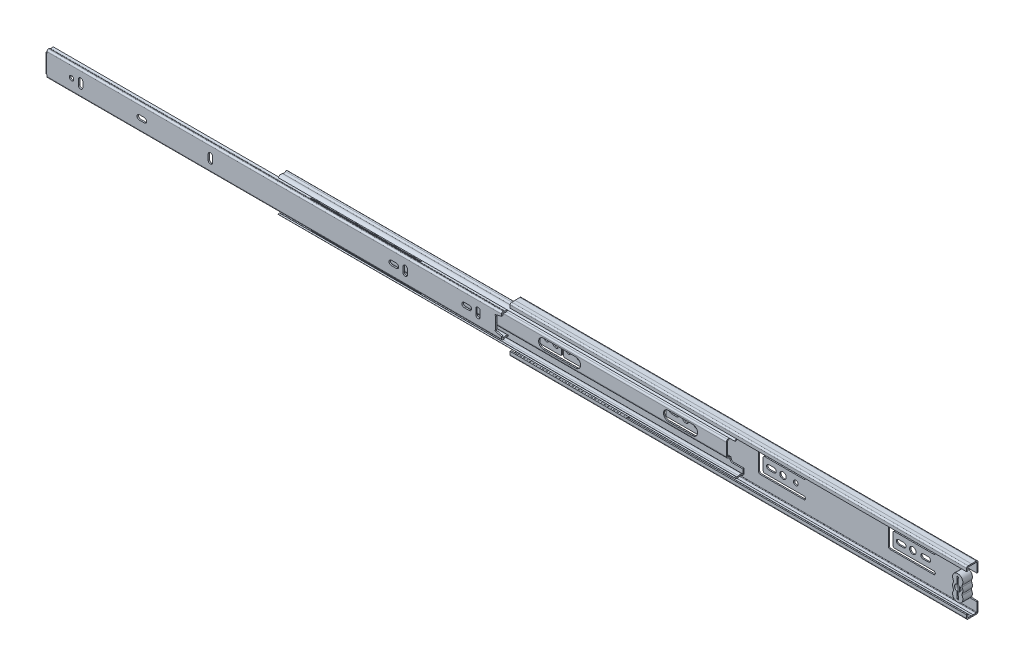
from build123d import *
from build123d.topology import SkipClean

# Parameters (mm, degrees)
EXTRUDE1_DEPTH      = 225.044
MIDDLE_MEMBER_DEPTH = 450.088
DRAWER_START        = -450.088
DRAWER_MEMBER_DEPTH = 450.088
SKETCH6_W           = 1.905
SKETCH6_H           = 12.147486483
CUT_EXTRUDE1_DEPTH  = 683.743710609
EXTRUDE4_DEPTH      = 8.89
CUT_EXTRUDE2_DEPTH  = 1.1938
SKETCH9_W           = 1.397
SKETCH9_H           = 7.493000005
EXTRUDE5_DEPTH      = 8.89
EXTRUDE6_DEPTH      = 1.016
EXTRUDE6_DEPTH_BACK = 8.382
CUT_EXTRUDE3_DEPTH  = 1.397
CUT_EXTRUDE4_DEPTH  = 683.660285626
CUT_EXTRUDE5_DEPTH  = 1.1938
CUT_EXTRUDE14_DEPTH = 1.1938
CUT_F_DEPTH         = 1.1938
CUT_G_DEPTH         = 1.1938
CUT_EXTRUDE15_DEPTH = 1.1938
SKETCH24_R          = 2.1844
CUT_EXTRUDE13_DEPTH = 1.397
CUT_E_DEPTH         = 1.397
CUT_C_DEPTH         = 1.397
CUT_EXTRUDE17_DEPTH = 1.2192
LPATTERN1_COUNT     = 6
LPATTERN1_PITCH     = 19.05
EXTRUDE7_DEPTH      = 6.35
EXTRUDE7_DEPTH_BACK = 101.6
SKETCH28_W          = 7.62
SKETCH28_H          = 0.762
LPATTERN2_COUNT     = 6
LPATTERN2_PITCH     = 19.05
EXTRUDE8_DEPTH      = 6.35
EXTRUDE8_DEPTH_BACK = 101.6
SKETCH30_W          = 5.08
SKETCH30_H          = 0.762


# Read off the part's stored shape, not the designer's step: Drawer Member
with BuildPart() as part:
    # Sketch1 → Extrude1 (new, symmetric)
    with BuildSketch(Plane(origin=(0, 0, 0), x_dir=(0, 0, -1), z_dir=(1, 0, 0))):
        with BuildLine():
            Line((-4.139279899, 22.8203125), (-0.743323143, 22.698920454))
            Line((-0.743323143, 22.698920454), (3.892452069, 22.8203125))
            ThreePointArc((3.892452069, 22.8203125), (5.124499805, 22.338098312), (5.6388, 21.119095664))
            Line((5.6388, 21.119095664), (5.6388, 0))
            Line((5.6388, 0), (4.445, 0))
            Line((4.445, 0), (4.445, 21.119095664))
            ThreePointArc((4.445, 21.119095664), (4.291477554, 21.482977052), (3.92370211, 21.626921585))
            Line((3.92370211, 21.626921585), (0.761857041, 21.544125758))
            ThreePointArc((0.761857041, 21.544125758), (-0.187154328, 21.71413397), (-1.131158407, 21.51822157))
            Line((-1.131158407, 21.51822157), (-4.181926298, 21.627274477))
            ThreePointArc((-4.181926298, 21.627274477), (-4.367367911, 21.55622161), (-4.445, 21.3734366))
            Line((-4.445, 21.3734366), (-4.445, 18.415))
            Line((-4.445, 18.415), (-5.6388, 18.415))
            Line((-5.6388, 18.415), (-5.6388, 21.3734366))
            ThreePointArc((-5.6388, 21.3734366), (-5.19629709, 22.415311161), (-4.139279899, 22.8203125))
        make_face()
    extrude(amount=EXTRUDE1_DEPTH, both=True)

    # Sketch8 → Cut-Extrude2 (cut)
    with BuildSketch(Plane.XY.offset(-4.445)):
        with BuildLine():
            Line((215.405533997, 7.645578895), (216.8398, 7.493000005))
            Line((216.8398, 7.493000005), (216.8398, 0))
            Line((216.8398, 0), (225.044, 0))
            Line((225.044, 0), (225.044, 12.204752384))
            Line((225.044, 12.204752384), (215.647356843, 12.204752384))
            ThreePointArc((215.647356843, 12.204752384), (213.364565723, 10.03983377), (215.405533997, 7.645578895))
        make_face()
    extrude(amount=-CUT_EXTRUDE2_DEPTH, mode=Mode.SUBTRACT)

    # Sketch9 → Extrude5 (add)
    with BuildSketch(Plane.XY.offset(-4.445)):
        with Locations((216.1413, 3.746500003)):
            Rectangle(SKETCH9_W, SKETCH9_H)
    extrude(amount=EXTRUDE5_DEPTH)

    # Sketch13 → Cut-Extrude5 (cut)
    with BuildSketch(Plane.XY.offset(-4.445)):
        with BuildLine():
            Line((-156.655699917, 7.112000069), (-181.484199931, 7.112000069))
            ThreePointArc((-181.484199931, 7.112000069), (-182.023015347, 6.888815416), (-182.2462, 6.35))
            Line((-182.2462, 6.35), (-182.2462, 0))
            Line((-182.2462, 0), (-184.5322, 0))
            Line((-184.5322, 0), (-184.5322, 6.35))
            ThreePointArc((-184.5322, 6.35), (-184.755384653, 6.888815416), (-185.294200069, 7.112000069))
            Line((-185.294200069, 7.112000069), (-207.582699917, 7.112000069))
            ThreePointArc((-207.582699917, 7.112000069), (-209.170199917, 8.699500069), (-207.582699917, 10.287000069))
            Line((-207.582699917, 10.287000069), (-156.655699917, 10.287000069))
            ThreePointArc((-156.655699917, 10.287000069), (-155.068199917, 8.699500069), (-156.655699917, 7.112000069))
        make_face()
        with BuildLine():
            Line((-162.269099917, 2.286), (-167.222099917, 2.286))
            ThreePointArc((-167.222099917, 2.286), (-168.838546018, 1.616446102), (-169.508099917, 0))
            Line((-169.508099917, 0), (-159.983099917, 0))
            ThreePointArc((-159.983099917, 0), (-160.652653815, 1.616446102), (-162.269099917, 2.286))
        make_face()
        with BuildLine():
            Line((-201.321599917, 0), (-196.749599917, 0))
            ThreePointArc((-196.749599917, 0), (-199.035599917, 2.286), (-201.321599917, 0))
        make_face()
        with BuildLine():
            Line((-193.219000083, 0), (-186.868999917, 0))
            ThreePointArc((-186.868999917, 0), (-190.044, 3.175000083), (-193.219000083, 0))
        make_face()
        with BuildLine():
            Line((-179.731599917, 0), (-175.159599917, 0))
            ThreePointArc((-175.159599917, 0), (-177.445599917, 2.286), (-179.731599917, 0))
        make_face()
    extrude(amount=-CUT_EXTRUDE5_DEPTH, mode=Mode.SUBTRACT)

    # Sketch32 → Cut-Extrude14 (cut)
    with BuildSketch(Plane(origin=(0, 0, -5.6388), x_dir=(-1, 0, 0), z_dir=(0, 0, -1))):
        with BuildLine():
            Line((44.5815, 0), (54.1065, 0))
            ThreePointArc((54.1065, 0), (53.436946102, 1.616446102), (51.8205, 2.286))
            Line((51.8205, 2.286), (46.8675, 2.286))
            ThreePointArc((46.8675, 2.286), (45.251053898, 1.616446102), (44.5815, 0))
        make_face()
        with BuildLine():
            Line((58.869, 0), (65.219, 0))
            ThreePointArc((65.219, 0), (62.044, 3.175), (58.869, 0))
        make_face()
        with BuildLine():
            Line((68.7115, 0), (78.2365, 0))
            ThreePointArc((78.2365, 0), (77.566946102, 1.616446102), (75.9505, 2.286))
            Line((75.9505, 2.286), (70.9975, 2.286))
            ThreePointArc((70.9975, 2.286), (69.381053898, 1.616446102), (68.7115, 0))
        make_face()
        with BuildLine():
            Line((81.602, 0), (86.174, 0))
            Line((86.174, 0), (86.174, 8.763000069))
            ThreePointArc((86.174, 8.763000069), (85.727630735, 9.840630803), (84.65, 10.287000069))
            Line((84.65, 10.287000069), (41.4065, 10.287000069))
            ThreePointArc((41.4065, 10.287000069), (39.819, 8.699500069), (41.4065, 7.112000069))
            Line((41.4065, 7.112000069), (80.078, 7.112000069))
            ThreePointArc((80.078, 7.112000069), (81.155630735, 6.665630803), (81.602, 5.588000069))
            Line((81.602, 5.588000069), (81.602, 0))
        make_face()
    extrude(amount=-CUT_EXTRUDE14_DEPTH, mode=Mode.SUBTRACT)

    # Sketch33 → Cut F (cut)
    with BuildSketch(Plane(origin=(83.609365602, 0.812450965, -5.6388), x_dir=(-1, 0, 0), z_dir=(0, 0, -1))):
        with BuildLine():
            Line((46.478365602, -0.812450965), (52.828365602, -0.812450965))
            ThreePointArc((52.828365602, -0.812450965), (49.653365602, 2.362549035), (46.478365602, -0.812450965))
        make_face()
        with BuildLine():
            Line((56.320865602, -0.812450965), (65.845865602, -0.812450965))
            ThreePointArc((65.845865602, -0.812450965), (65.176311704, 0.803995136), (63.559865602, 1.473549035))
            Line((63.559865602, 1.473549035), (58.606865602, 1.473549035))
            ThreePointArc((58.606865602, 1.473549035), (56.9904195, 0.803995136), (56.320865602, -0.812450965))
        make_face()
        with BuildLine():
            Line((69.211365602, -0.812450965), (73.783365602, -0.812450965))
            Line((73.783365602, -0.812450965), (73.783365602, 7.950549103))
            ThreePointArc((73.783365602, 7.950549103), (73.336996337, 9.028179838), (72.259365602, 9.474549103))
            Line((72.259365602, 9.474549103), (29.015865602, 9.474549103))
            ThreePointArc((29.015865602, 9.474549103), (27.428365602, 7.887049103), (29.015865602, 6.299549103))
            Line((29.015865602, 6.299549103), (67.687365602, 6.299549103))
            ThreePointArc((67.687365602, 6.299549103), (68.764996337, 5.853179838), (69.211365602, 4.775549103))
            Line((69.211365602, 4.775549103), (69.211365602, -0.812450965))
        make_face()
        with BuildLine():
            Line((34.667365602, -0.812450965), (39.239365602, -0.812450965))
            ThreePointArc((39.239365602, -0.812450965), (36.953365602, 1.473549035), (34.667365602, -0.812450965))
        make_face()
    extrude(amount=-CUT_F_DEPTH, mode=Mode.SUBTRACT)

    # Sketch34 → Cut G (cut)
    with BuildSketch(Plane(origin=(169.823604257, 1.452669916, -5.6388), x_dir=(-1, 0, 0), z_dir=(0, 0, -1))):
        with BuildLine():
            Line((-9.594895743, -1.452669916), (-0.069895743, -1.452669916))
            ThreePointArc((-0.069895743, -1.452669916), (-0.739449642, 0.163776186), (-2.355895743, 0.833330084))
            Line((-2.355895743, 0.833330084), (-7.308895743, 0.833330084))
            ThreePointArc((-7.308895743, 0.833330084), (-8.925341845, 0.163776186), (-9.594895743, -1.452669916))
        make_face()
        with BuildLine():
            Line((4.692604257, -1.452669916), (11.042604257, -1.452669916))
            ThreePointArc((11.042604257, -1.452669916), (7.867604257, 1.722330084), (4.692604257, -1.452669916))
        make_face()
        with BuildLine():
            Line((14.535104257, -1.452669916), (24.060104257, -1.452669916))
            ThreePointArc((24.060104257, -1.452669916), (23.390550358, 0.163776186), (21.774104257, 0.833330084))
            Line((21.774104257, 0.833330084), (16.821104257, 0.833330084))
            ThreePointArc((16.821104257, 0.833330084), (15.204658155, 0.163776186), (14.535104257, -1.452669916))
        make_face()
        with BuildLine():
            Line((27.425604257, -1.452669916), (31.997604257, -1.452669916))
            Line((31.997604257, -1.452669916), (31.997604257, 7.310330153))
            ThreePointArc((31.997604257, 7.310330153), (31.551234991, 8.387960887), (30.473604257, 8.834330153))
            Line((30.473604257, 8.834330153), (-12.769895743, 8.834330153))
            ThreePointArc((-12.769895743, 8.834330153), (-14.357395743, 7.246830153), (-12.769895743, 5.659330153))
            Line((-12.769895743, 5.659330153), (25.901604257, 5.659330153))
            ThreePointArc((25.901604257, 5.659330153), (26.979234991, 5.212960887), (27.425604257, 4.135330153))
            Line((27.425604257, 4.135330153), (27.425604257, -1.452669916))
        make_face()
    extrude(amount=-CUT_G_DEPTH, mode=Mode.SUBTRACT)

    # Sketch31 → Cut-Extrude15 (cut)
    with BuildSketch(Plane(origin=(0, 0, -5.6388), x_dir=(-1, 0, 0), z_dir=(0, 0, -1))):
        with BuildLine():
            Line((-209.169, 0), (-202.819, 0))
            ThreePointArc((-202.819, 0), (-205.994, 3.175), (-209.169, 0))
        make_face()
    extrude(amount=-CUT_EXTRUDE15_DEPTH, mode=Mode.SUBTRACT)

    # Mirror3 4: part across plane


with BuildPart() as body_2:
    # Sketch2 → Middle Member (new body)
    with BuildSketch(Plane.ZY.offset(453.644)):
        with BuildLine():
            ThreePointArc((5.7404, 15.627692517), (3.735864231, 17.127444277), (1.241474216, 16.914283663))
            ThreePointArc((1.241474216, 16.914283663), (-0.188944013, 16.688900955), (-1.505642365, 17.291560999))
            ThreePointArc((-1.505642365, 17.291560999), (-2.813430342, 17.487614783), (-3.53059999, 16.376572852))
            Line((-3.53059999, 16.376572852), (-3.53059999, 9.521737984))
            ThreePointArc((-3.53059999, 9.521737984), (-3.220327109, 8.457239952), (-2.386691239, 7.726160915))
            Line((-2.386691239, 7.726160915), (-0.414564934, 6.806543316))
            ThreePointArc((-0.414564934, 6.806543316), (-0.093935732, 6.525359052), (0.0254, 6.115936705))
            Line((0.0254, 6.115936705), (0.0254, 0))
            Line((0.0254, 0), (1.2446, 0))
            Line((1.2446, 0), (1.2446, 6.115936705))
            ThreePointArc((1.2446, 6.115936705), (0.934327119, 7.180434735), (0.100691251, 7.91151377))
            Line((0.100691251, 7.91151377), (-1.871435054, 8.831131369))
            ThreePointArc((-1.871435054, 8.831131369), (-2.192064258, 9.112315634), (-2.31139999, 9.521737984))
            Line((-2.31139999, 9.521737984), (-2.31139999, 16.376572852))
            ThreePointArc((-2.31139999, 16.376572852), (-2.311399987, 16.376572856), (-2.311399982, 16.376572855))
            ThreePointArc((-2.311399982, 16.376572855), (-0.35482671, 15.481038557), (1.770730805, 15.815950333))
            ThreePointArc((1.770730805, 15.815950333), (3.400639083, 15.955235789), (4.710462095, 14.975253591))
            Line((4.710462095, 14.975253591), (5.7404, 15.627692517))
        make_face()
    extrude(amount=-MIDDLE_MEMBER_DEPTH)

    # Sketch12 → Cut-Extrude4 (cut, through all)
    with BuildSketch(Plane.XY.offset(1.2446)):
        with BuildLine():
            Line((-3.556, 12.065), (-13.716, 12.065))
            ThreePointArc((-13.716, 12.065), (-15.512051224, 11.321051224), (-16.256, 9.525))
            Line((-16.256, 9.525), (-16.256, 0))
            Line((-16.256, 0), (-3.556, 0))
            Line((-3.556, 0), (-3.556, 12.065))
        make_face()
    extrude(amount=-CUT_EXTRUDE4_DEPTH, mode=Mode.SUBTRACT)

    # Sketch26 → Cut-Extrude17 (cut)
    with BuildSketch(Plane.XY.offset(1.2446)):
        with BuildLine():
            Line((-201.321599917, 0), (-159.983099917, 0))
            ThreePointArc((-159.983099917, 0), (-161.396602591, 3.412497326), (-164.809099917, 4.826))
            Line((-164.809099917, 4.826), (-196.495599917, 4.826))
            ThreePointArc((-196.495599917, 4.826), (-199.908097243, 3.412497326), (-201.321599917, 0))
        make_face()
        with BuildLine():
            Line((-44.5815, 0), (-78.2365, 0))
            ThreePointArc((-78.2365, 0), (-76.822997326, 3.412497326), (-73.4105, 4.826))
            Line((-73.4105, 4.826), (-49.4075, 4.826))
            ThreePointArc((-49.4075, 4.826), (-45.995002674, 3.412497326), (-44.5815, 0))
        make_face()
        with BuildLine():
            Line((51.4185, 0), (17.7635, 0))
            ThreePointArc((17.7635, 0), (19.177002674, 3.412497326), (22.5895, 4.826))
            Line((22.5895, 4.826), (46.5925, 4.826))
            ThreePointArc((46.5925, 4.826), (50.004997326, 3.412497326), (51.4185, 0))
        make_face()
    extrude(amount=-CUT_EXTRUDE17_DEPTH, mode=Mode.SUBTRACT)

    # Mirror3 3: body 2 across plane


with BuildPart() as body_3:
    # Drawer Member outline → Drawer Member (new body)
    with BuildSketch(Plane.ZY.offset(682.244).offset(DRAWER_START)):
        with BuildLine():
            Line((5.6642, 0), (7.0612, 0))
            Line((7.0612, 0), (7.0612, 10.623486483))
            ThreePointArc((7.0612, 10.623486483), (6.614830734, 11.701117218), (5.5372, 12.147486483))
            Line((5.5372, 12.147486483), (5.164341455, 12.147486483))
            ThreePointArc((5.164341455, 12.147486483), (4.67440708, 12.066587417), (4.236487447, 11.83247901))
            ThreePointArc((4.236487447, 11.83247901), (2.709144677, 11.334862777), (1.208194452, 11.907179363))
            Line((1.208194452, 11.907179363), (0.304054167, 10.842219578))
            ThreePointArc((0.304054167, 10.842219578), (2.674694689, 9.938287609), (5.087020295, 10.724235863))
            ThreePointArc((5.087020295, 10.724235863), (5.123513594, 10.743744895), (5.164341455, 10.750486483))
            Line((5.164341455, 10.750486483), (5.5372, 10.750486483))
            ThreePointArc((5.5372, 10.750486483), (5.627002561, 10.713289044), (5.6642, 10.623486483))
            Line((5.6642, 10.623486483), (5.6642, 0))
        make_face()
    extrude(amount=DRAWER_MEMBER_DEPTH)

    # Sketch6 → Cut-Extrude1 (cut, through all)
    with BuildSketch(Plane.XY.offset(7.0612)):
        with Locations((-681.2915, 6.073743242)):
            Rectangle(SKETCH6_W, SKETCH6_H)
    extrude(amount=-CUT_EXTRUDE1_DEPTH, mode=Mode.SUBTRACT)

    # Sketch7 → Extrude4 (add)
    with BuildSketch(Plane.XZ):
        with BuildLine():
            Line((-680.339, 7.0612), (-680.593, 7.0612))
            ThreePointArc((-680.593, 7.0612), (-681.760433296, 6.577633296), (-682.244, 5.4102))
            Line((-682.244, 5.4102), (-682.244, 0.304054167))
            Line((-682.244, 0.304054167), (-680.847, 0.304054167))
            Line((-680.847, 0.304054167), (-680.847, 5.4102))
            ThreePointArc((-680.847, 5.4102), (-680.772605122, 5.589805122), (-680.593, 5.6642))
            Line((-680.593, 5.6642), (-680.339, 5.6642))
            Line((-680.339, 5.6642), (-680.339, 7.0612))
        make_face()
    extrude(amount=-EXTRUDE4_DEPTH)

    # Sketch11 → Cut-Extrude3 (cut)
    with BuildSketch(Plane.XY.offset(7.0612)):
        with BuildLine():
            Line((-237.870951398, 5.967847879), (-237.871, 0))
            Line((-237.871, 0), (-232.156, 0))
            Line((-232.156, 0), (-232.156, 8.589285844))
            Line((-232.156, 8.589285844), (-238.015326457, 7.221216084))
            ThreePointArc((-238.015326457, 7.221216084), (-238.501774848, 6.530182899), (-237.870951398, 5.967847879))
        make_face()
    extrude(amount=-CUT_EXTRUDE3_DEPTH, mode=Mode.SUBTRACT)

    # Sketch24 → Cut-Extrude13 (cut)
    with BuildSketch(Plane.XY.offset(7.0612)):
        with Locations((-656.082, 0)):
            Circle(SKETCH24_R)
        with BuildLine():
            Line((-649.3764, 2.6416), (-649.3764, 0))
            Line((-649.3764, 0), (-645.0076, 0))
            Line((-645.0076, 0), (-645.0076, 2.6416))
            ThreePointArc((-645.0076, 2.6416), (-647.192, 4.826), (-649.3764, 2.6416))
        make_face()
        with BuildLine():
            Line((-591.5025, 0), (-581.9775, 0))
            ThreePointArc((-581.9775, 0), (-582.647053898, 1.616446102), (-584.2635, 2.286))
            Line((-584.2635, 2.286), (-589.2165, 2.286))
            ThreePointArc((-589.2165, 2.286), (-590.832946102, 1.616446102), (-591.5025, 0))
        make_face()
        with BuildLine():
            Line((-521.3764, 2.6416), (-521.3764, 0))
            Line((-521.3764, 0), (-517.0076, 0))
            Line((-517.0076, 0), (-517.0076, 2.6416))
            ThreePointArc((-517.0076, 2.6416), (-519.192, 4.826), (-521.3764, 2.6416))
        make_face()
    extrude(amount=-CUT_EXTRUDE13_DEPTH, mode=Mode.SUBTRACT)

    # Sketch25 → Cut E (cut)
    with BuildSketch(Plane.XY.offset(7.0612)):
        with BuildLine():
            Line((-257.4544, 0), (-253.0856, 0))
            Line((-253.0856, 0), (-253.0856, 2.6416))
            ThreePointArc((-253.0856, 2.6416), (-255.27, 4.826), (-257.4544, 2.6416))
            Line((-257.4544, 2.6416), (-257.4544, 0))
        make_face()
        with BuildLine():
            Line((-261.6835, 0), (-271.2085, 0))
            ThreePointArc((-271.2085, 0), (-270.538946102, 1.616446102), (-268.9225, 2.286))
            Line((-268.9225, 2.286), (-263.9695, 2.286))
            ThreePointArc((-263.9695, 2.286), (-262.353053898, 1.616446102), (-261.6835, 0))
        make_face()
    extrude(amount=-CUT_E_DEPTH, mode=Mode.SUBTRACT)

    # Sketch35 → Cut C (cut)
    with BuildSketch(Plane.XY.offset(7.0612)):
        with BuildLine():
            Line((-329.3364, 0), (-324.9676, 0))
            Line((-324.9676, 0), (-324.9676, 2.6416))
            ThreePointArc((-324.9676, 2.6416), (-327.152, 4.826), (-329.3364, 2.6416))
            Line((-329.3364, 2.6416), (-329.3364, 0))
        make_face()
        with BuildLine():
            Line((-333.5655, 0), (-343.0905, 0))
            ThreePointArc((-343.0905, 0), (-342.420946102, 1.616446102), (-340.8045, 2.286))
            Line((-340.8045, 2.286), (-335.8515, 2.286))
            ThreePointArc((-335.8515, 2.286), (-334.235053898, 1.616446102), (-333.5655, 0))
        make_face()
    extrude(amount=-CUT_C_DEPTH, mode=Mode.SUBTRACT)

    # Mirror3 2: body 3 across plane


with BuildPart() as body_4:
    # Sketch10 → Extrude6 (new, two sides: drawn at the far end of the back side and taken through both)
    with BuildSketch(Plane.XY.offset(4.445).offset(-EXTRUDE6_DEPTH_BACK)):
        with BuildLine():
            Line((211.0613, 0), (212.9663, 0))
            ThreePointArc((212.9663, 0), (213.65646946, 1.976421561), (215.426925, 3.093589074))
            Line((215.426925, 3.093589074), (215.426925, 9.8425))
            Line((215.426925, 9.8425), (216.855675, 9.8425))
            Line((216.855675, 9.8425), (216.855675, 3.093589074))
            ThreePointArc((216.855675, 3.093589074), (218.62613054, 1.976421561), (219.3163, 0))
            Line((219.3163, 0), (221.2213, 0))
            ThreePointArc((221.2213, 0), (221.014650432, 1.434174174), (220.411514345, 2.751666667))
            ThreePointArc((220.411514345, 2.751666667), (220.158456328, 3.6115625), (220.411514345, 4.471458333))
            ThreePointArc((220.411514345, 4.471458333), (216.1413, 12.303125), (211.871085655, 4.471458333))
            ThreePointArc((211.871085655, 4.471458333), (212.124143672, 3.6115625), (211.871085655, 2.751666667))
            ThreePointArc((211.871085655, 2.751666667), (211.267949568, 1.434174174), (211.0613, 0))
        make_face()
    extrude(amount=EXTRUDE6_DEPTH + EXTRUDE6_DEPTH_BACK)

    # Mirror3: body 4 across plane


with BuildPart() as body_5:
    # Sketch27 → Revolve1 (revolve)
    with BuildSketch(Plane.ZY.offset(212.344)):
        with BuildLine():
            Line((0.1524, 21.683172421), (0.1524, 16.665571078))
            ThreePointArc((0.1524, 16.665571078), (2.661200671, 19.174371749), (0.1524, 21.683172421))
        make_face()
    revolve(axis=Axis((-212.344, 23.635004298, 0.1524), (0, -1, 0)))


with BuildPart() as lpattern1_1:
    # LPattern1: pattern copy
    add(body_5.part.moved(Location(Vector(1, 0, 0) * (1 * LPATTERN1_PITCH))))


with BuildPart() as lpattern1_2:
    # LPattern1: pattern copy
    add(body_5.part.moved(Location(Vector(1, 0, 0) * (2 * LPATTERN1_PITCH))))


with BuildPart() as lpattern1_3:
    # LPattern1: pattern copy
    add(body_5.part.moved(Location(Vector(1, 0, 0) * (3 * LPATTERN1_PITCH))))


with BuildPart() as lpattern1_4:
    # LPattern1: pattern copy
    add(body_5.part.moved(Location(Vector(1, 0, 0) * (4 * LPATTERN1_PITCH))))


with BuildPart() as lpattern1_5:
    # LPattern1: pattern copy
    add(body_5.part.moved(Location(Vector(1, 0, 0) * (5 * LPATTERN1_PITCH))))


with BuildPart() as body_5_1:
    add(body_5.part)

    add(lpattern1_1.part)  # Extrude7 merges LPattern1_1

    add(lpattern1_2.part)  # Extrude7 merges LPattern1_2

    add(lpattern1_3.part)  # Extrude7 merges LPattern1_3

    add(lpattern1_4.part)  # Extrude7 merges LPattern1_4

    add(lpattern1_5.part)  # Extrude7 merges LPattern1_5
    # Sketch28 → Extrude7 (add, two sides: drawn at the far end of the back side and taken through both)
    with BuildSketch(Plane.ZY.offset(212.344).offset(-EXTRUDE7_DEPTH_BACK)):
        with Locations((0.1524, 19.174371749)):
            Rectangle(SKETCH28_W, SKETCH28_H)
    extrude(amount=EXTRUDE7_DEPTH + EXTRUDE7_DEPTH_BACK)


with BuildPart() as body_6:
    # Sketch29 → Revolve2 (revolve)
    with BuildSketch(Plane.ZY.offset(415.544)):
        with BuildLine():
            Line((2.7686, 16.043834368), (2.7686, 11.446434358))
            ThreePointArc((2.7686, 11.446434358), (5.067300005, 13.745134363), (2.7686, 16.043834368))
        make_face()
    revolve(axis=Axis((-415.544, 16.680143034, 2.7686), (0, -1, 0)))


with BuildPart() as lpattern2_1:
    # LPattern2: pattern copy
    add(body_6.part.moved(Location(Vector(1, 0, 0) * (1 * LPATTERN2_PITCH))))


with BuildPart() as lpattern2_2:
    # LPattern2: pattern copy
    add(body_6.part.moved(Location(Vector(1, 0, 0) * (2 * LPATTERN2_PITCH))))


with BuildPart() as lpattern2_3:
    # LPattern2: pattern copy
    add(body_6.part.moved(Location(Vector(1, 0, 0) * (3 * LPATTERN2_PITCH))))


with BuildPart() as lpattern2_4:
    # LPattern2: pattern copy
    add(body_6.part.moved(Location(Vector(1, 0, 0) * (4 * LPATTERN2_PITCH))))


with BuildPart() as lpattern2_5:
    # LPattern2: pattern copy
    add(body_6.part.moved(Location(Vector(1, 0, 0) * (5 * LPATTERN2_PITCH))))


with BuildPart() as body_6_1:
    add(body_6.part)

    add(lpattern2_1.part)  # Extrude8 merges LPattern2_1

    add(lpattern2_2.part)  # Extrude8 merges LPattern2_2

    add(lpattern2_3.part)  # Extrude8 merges LPattern2_3

    add(lpattern2_4.part)  # Extrude8 merges LPattern2_4

    add(lpattern2_5.part)  # Extrude8 merges LPattern2_5
    # Sketch30 → Extrude8 (add, two sides: drawn at the far end of the back side and taken through both)
    with BuildSketch(Plane.ZY.offset(415.544).offset(-EXTRUDE8_DEPTH_BACK)):
        with Locations((2.7686, 13.745134363)):
            Rectangle(SKETCH30_W, SKETCH30_H)
    extrude(amount=EXTRUDE8_DEPTH + EXTRUDE8_DEPTH_BACK)


with BuildPart() as body_4_1:
    add(body_4.part)
    add(body_4.part.mirror(Plane.ZX))


with BuildPart() as body_3_1:
    with SkipClean():  # the faces are left unmerged after this step: merging them gives an invalid solid
        add(body_3.part)
        add(body_3.part.mirror(Plane.ZX))


with BuildPart() as body_2_1:
    add(body_2.part)
    add(body_2.part.mirror(Plane.ZX))


with BuildPart() as part_1:
    with SkipClean():  # the faces are left unmerged after this step: merging them gives an invalid solid
        add(part.part)
        add(part.part.mirror(Plane.ZX))


with BuildPart() as body_7:
    # Mirror5: mirrored copy
    add(body_6_1.part.mirror(Plane.ZX))


with BuildPart() as body_8:
    # Mirror5 2: mirrored copy
    add(body_5_1.part.mirror(Plane.ZX))


solid = Compound([body_5_1.part, body_6_1.part, body_4_1.part, body_3_1.part, body_2_1.part, part_1.part, body_7.part, body_8.part])
